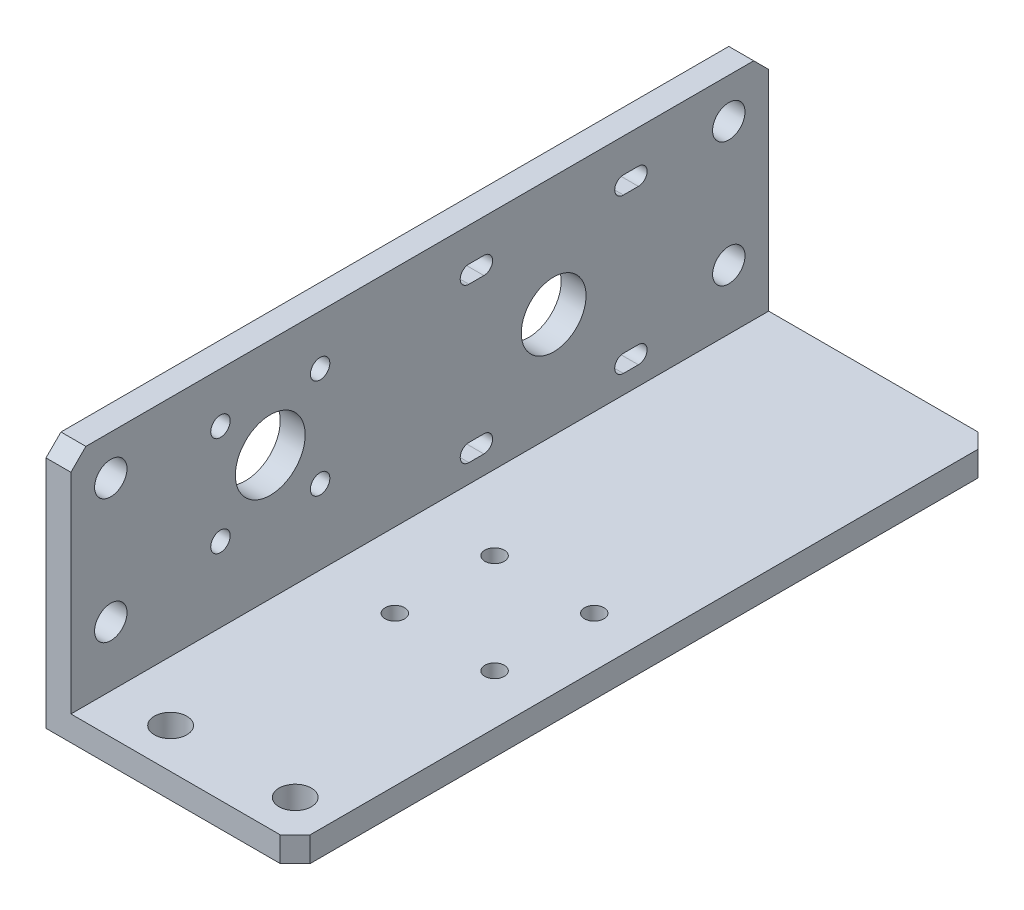
from build123d import *

# Parameters (mm, degrees)
ESTRUSIONE_ESTRUSIONE1_DEPTH = 140
FORO_6_5_6_5_1_D             = 6.5
FORO_6_5_6_5_2_AT_2_COUNT    = 2
FORO_6_5_6_5_2_AT_2_PITCH    = 25
TAGLIO_ESTRUSIONE2_REACH     = 158.844
SCHIZZO9_R                   = 7
TAGLIO_ESTRUSIONE4_REACH     = 158.844
SCHIZZO11_R                  = 6.5
SMUSSO1_SIZE                 = 3
M3_5_CLEARANCE_HOLE1_D       = 3.9
M3_5_CLEARANCE_HOLE2_D       = 3.9


with BuildPart() as part:
    # Schizzo1 → Estrusione-Estrusione1 (new body)
    with BuildSketch(Plane.XY):
        Polygon((0, 0), (0, 50), (5, 50), (5, 5), (50, 5), (50, 0), align=None)
    extrude(amount=ESTRUSIONE_ESTRUSIONE1_DEPTH)

    # Foro Ø6.5 (6.5)-1 (through all)
    with Locations(Plane(origin=(0, 0, 0), x_dir=(-1, 0, 0), z_dir=(0, -1, 0))):
        with Locations((-17, -132), (-42, -132)):
            Hole(FORO_6_5_6_5_1_D / 2)

    # Schizzo6 → Foro Ø6.5 (6.5)-2 (revolve, cut)
    with BuildSketch(Plane(origin=(0, 42, 132), x_dir=(0, 0, 1), z_dir=(0, 1, 0))):
        Polygon((0, 0), (0, 6.952797012), (3.25, 5), (3.25, 0), align=None)
    foro_6_5_6_5_2 = revolve(axis=Axis((-6.35, 42, 132), (1, 0, 0)), mode=Mode.SUBTRACT)

    # Foro Ø6.5 (6.5)-2 at 2: Foro Ø6.5 (6.5)-2 ×2
    with Locations(*[(0, -i * FORO_6_5_6_5_2_AT_2_PITCH, 0) for i in range(1, FORO_6_5_6_5_2_AT_2_COUNT)]):
        add(foro_6_5_6_5_2, mode=Mode.SUBTRACT)

    # Specchia1: Foro Ø6.5 (6.5)-2 across plane
    add(foro_6_5_6_5_2.mirror(Plane.XY.offset(70)), mode=Mode.SUBTRACT)

    # Specchia1 copy 1 sketch → Specchia1 copy 1 (revolve, cut)
    with BuildSketch(Plane(origin=(0, 17, 8), x_dir=(0, 0, -1), z_dir=(0, 1, 0))):
        Polygon((0, 0), (0, -6.952797012), (3.25, -5), (3.25, 0), align=None)
    revolve(axis=Axis((-6.35, 17, 8), (-1, 0, 0)), mode=Mode.SUBTRACT)

    # Schizzo9 → Taglio-Estrusione2 (cut, up to next)
    with BuildSketch(Plane.ZY, mode=Mode.PRIVATE) as taglio_estrusione2_sk1:
        with Locations((100, 30)):
            Circle(SCHIZZO9_R)
    taglio_estrusione2_tool1 = extrude(taglio_estrusione2_sk1.sketch, amount=-TAGLIO_ESTRUSIONE2_REACH, mode=Mode.PRIVATE) & part.part
    add(taglio_estrusione2_tool1.solids().sort_by_distance((0, 30, 100))[0], mode=Mode.SUBTRACT)

    # Schizzo11 → Taglio-Estrusione4 (cut, up to next)
    with BuildSketch(Plane.ZY, mode=Mode.PRIVATE) as taglio_estrusione4_sk1:
        with Locations((43.140524097, 26)):
            Circle(SCHIZZO11_R)
    taglio_estrusione4_tool1 = extrude(taglio_estrusione4_sk1.sketch, amount=-TAGLIO_ESTRUSIONE4_REACH, mode=Mode.PRIVATE) & part.part
    # Schizzo11 → Taglio-Estrusione4 (cut, up to next)
    with BuildSketch(Plane.ZY, mode=Mode.PRIVATE) as taglio_estrusione4_sk2:
        with BuildLine():
            Line((60.140524097, 39.75), (57.140524097, 39.75))
            ThreePointArc((57.140524097, 39.75), (55.390524097, 41.5), (57.140524097, 43.25))
            Line((57.140524097, 43.25), (60.140524097, 43.25))
            ThreePointArc((60.140524097, 43.25), (61.890524097, 41.5), (60.140524097, 39.75))
        make_face()
    taglio_estrusione4_tool2 = extrude(taglio_estrusione4_sk2.sketch, amount=-TAGLIO_ESTRUSIONE4_REACH, mode=Mode.PRIVATE) & part.part
    # Schizzo11 → Taglio-Estrusione4 (cut, up to next)
    with BuildSketch(Plane.ZY, mode=Mode.PRIVATE) as taglio_estrusione4_sk3:
        with BuildLine():
            Line((60.140524097, 12.25), (57.140524097, 12.25))
            ThreePointArc((57.140524097, 12.25), (55.390524097, 10.5), (57.140524097, 8.75))
            Line((57.140524097, 8.75), (60.140524097, 8.75))
            ThreePointArc((60.140524097, 8.75), (61.890524097, 10.5), (60.140524097, 12.25))
        make_face()
    taglio_estrusione4_tool3 = extrude(taglio_estrusione4_sk3.sketch, amount=-TAGLIO_ESTRUSIONE4_REACH, mode=Mode.PRIVATE) & part.part
    # Schizzo11 → Taglio-Estrusione4 (cut, up to next)
    with BuildSketch(Plane.ZY, mode=Mode.PRIVATE) as taglio_estrusione4_sk4:
        with BuildLine():
            Line((26.140524097, 12.25), (29.140524097, 12.25))
            ThreePointArc((29.140524097, 12.25), (30.890524097, 10.5), (29.140524097, 8.75))
            Line((29.140524097, 8.75), (26.140524097, 8.75))
            ThreePointArc((26.140524097, 8.75), (24.390524097, 10.5), (26.140524097, 12.25))
        make_face()
    taglio_estrusione4_tool4 = extrude(taglio_estrusione4_sk4.sketch, amount=-TAGLIO_ESTRUSIONE4_REACH, mode=Mode.PRIVATE) & part.part
    # Schizzo11 → Taglio-Estrusione4 (cut, up to next)
    with BuildSketch(Plane.ZY, mode=Mode.PRIVATE) as taglio_estrusione4_sk5:
        with BuildLine():
            Line((26.140524097, 39.75), (29.140524097, 39.75))
            ThreePointArc((29.140524097, 39.75), (30.890524097, 41.5), (29.140524097, 43.25))
            Line((29.140524097, 43.25), (26.140524097, 43.25))
            ThreePointArc((26.140524097, 43.25), (24.390524097, 41.5), (26.140524097, 39.75))
        make_face()
    taglio_estrusione4_tool5 = extrude(taglio_estrusione4_sk5.sketch, amount=-TAGLIO_ESTRUSIONE4_REACH, mode=Mode.PRIVATE) & part.part
    add(taglio_estrusione4_tool1.solids().sort_by_distance((0, 26, 43.140524))[0], mode=Mode.SUBTRACT)
    add(taglio_estrusione4_tool2.solids().sort_by_distance((0, 41.5, 58.640524))[0], mode=Mode.SUBTRACT)
    add(taglio_estrusione4_tool3.solids().sort_by_distance((0, 10.5, 58.640524))[0], mode=Mode.SUBTRACT)
    add(taglio_estrusione4_tool4.solids().sort_by_distance((0, 10.5, 27.640524))[0], mode=Mode.SUBTRACT)
    add(taglio_estrusione4_tool5.solids().sort_by_distance((0, 41.5, 27.640524))[0], mode=Mode.SUBTRACT)

    # Smusso1
    smusso1_edges = [part.edges().sort_by_distance(p)[0] for p in [
        (50, 2.5, 0),
        (2.5, 50, 0),
        (2.5, 50, 140),
        (50, 2.5, 140),
    ]]
    chamfer(smusso1_edges, length=SMUSSO1_SIZE)

    # M3.5 Clearance Hole1 (through all)
    with Locations(Plane(origin=(0, 40, 90), x_dir=(0, 0, -1), z_dir=(-1, 0, 0))):
        with Locations((0, 0), (-20, 0), (-20, 20), (0, 20)):
            Hole(M3_5_CLEARANCE_HOLE1_D / 2)

    # M3.5 Clearance Hole2 (through all)
    with Locations(Plane(origin=(20, 0, 90), x_dir=(-1, 0, 0), z_dir=(0, -1, 0))):
        with Locations((0, 0), (-20, 0), (-20, 20), (0, 20)):
            Hole(M3_5_CLEARANCE_HOLE2_D / 2)


solid = part.part
